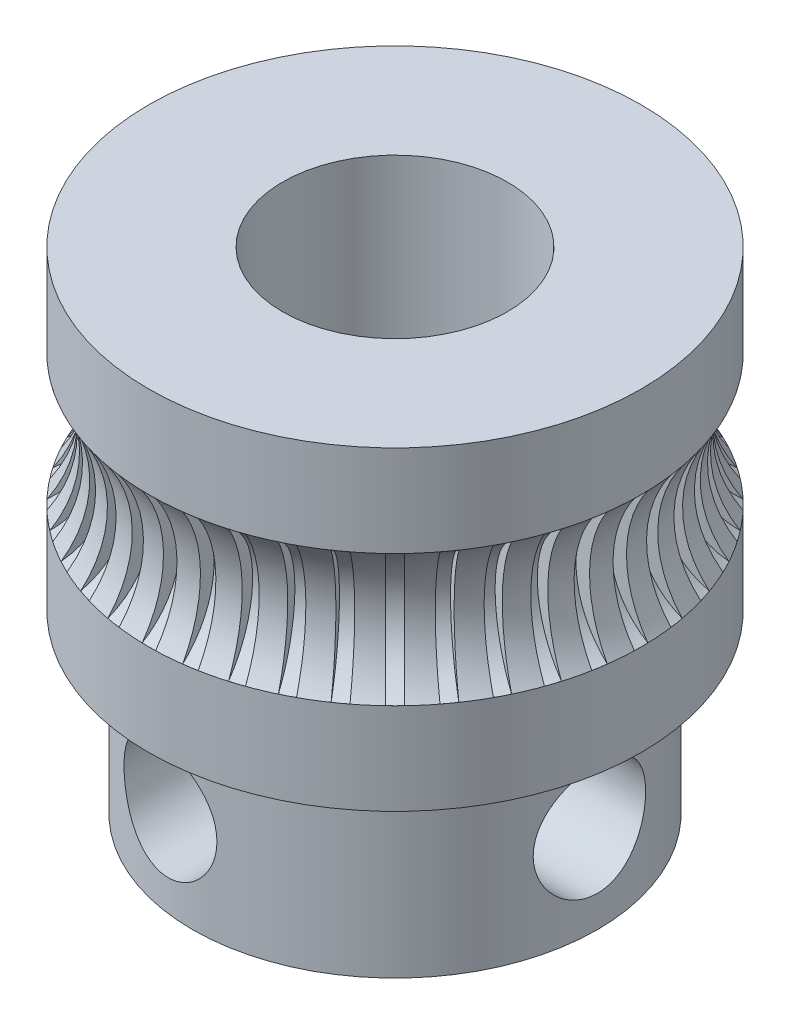
from build123d import *

# Parameters (mm, degrees)
CROQUIS1_W                          = 5.475
CROQUIS1_H                          = 7
CROQUIS2_R                          = 4.5
SALIENTE_EXTRUIR1_DEPTH             = 3.9
DI_METRO_DE_TALADRO_5_0_5_1_D       = 5
DI_METRO_DE_TALADRO_2_5_2_5_1_D     = 2.5
DI_METRO_DE_TALADRO_2_5_2_5_1_DEPTH = 3.309936491
CROQUIS7_W                          = 1.25
CROQUIS7_H                          = 3.960443852
CROQUIS23_R                         = 1.7
CORTAR_EXTRUIR1_DEPTH               = 0.15
MATRIZC1_COUNT                      = 40
CROQUIS15_R                         = 2.5


with BuildPart() as part:
    # Croquis1 → Revolución1 (revolve)
    with BuildSketch(Plane.XY.offset(-56.4)):
        with Locations((78.2375, 52.926431985)):
            Rectangle(CROQUIS1_W, CROQUIS1_H)
    revolve(axis=Axis((75.5, 56.426431985, -56.4), (0, -1, 0)))

    # Croquis2 → Saliente-Extruir1 (add)
    with BuildSketch(Plane.XZ.offset(-49.426431985)):
        with Locations((75.5, -56.4)):
            Circle(CROQUIS2_R)
    extrude(amount=SALIENTE_EXTRUIR1_DEPTH)

    # Diámetro de taladro Ø5.0 (5)1 (through all)
    with Locations(Plane(origin=(0, 56.426431985, 0), x_dir=(1, 0, 0), z_dir=(0, 1, 0))):
        with Locations((75.5, 56.4)):
            Hole(DI_METRO_DE_TALADRO_5_0_5_1_D / 2)

    # Diámetro de taladro Ø2.5 (2.5)1
    with Locations(Plane.ZY.offset(-77.665063509)):
        with Locations((-56.4, 47.476431985)):
            Hole(DI_METRO_DE_TALADRO_2_5_2_5_1_D / 2, depth=DI_METRO_DE_TALADRO_2_5_2_5_1_DEPTH)

    # Croquis7 → Diámetro de taladro Ø2.5 (2.5)2 (revolve, cut)
    with BuildSketch(Plane(origin=(74.761000333, 47.459423849, -54.885443852), x_dir=(0, 1, 0), z_dir=(1, 0, 0))):
        with Locations((0.625, 1.980221926)):
            Rectangle(CROQUIS7_W, CROQUIS7_H)
    revolve(axis=Axis((74.761000333, 47.459423849, -61.235443852), (0, 0, 1)), mode=Mode.SUBTRACT)

    # Croquis23 → Cortar-Extruir1 (cut, symmetric)
    with BuildSketch(Plane.ZY.offset(-75.5)):
        with Locations((-50.064404276, 52.926431985)):
            Circle(CROQUIS23_R)
    cortar_extruir1 = extrude(amount=CORTAR_EXTRUIR1_DEPTH, both=True, mode=Mode.SUBTRACT)

    # MatrizC1: Cortar-Extruir1 ×40 about axis
    matrizc1_axis = Axis((75.5, 56.426431985, -56.4), (0, -1, 0))
    for i in range(1, MATRIZC1_COUNT):
        add(cortar_extruir1.rotate(matrizc1_axis, i * 360 / MATRIZC1_COUNT), mode=Mode.SUBTRACT)

    # Cortar-Barrer1: sweep along a path in Croquis24
    with BuildLine(Plane(origin=(0, 56.426431985, 0), x_dir=(1, 0, 0), z_dir=(0, 1, 0))) as cortar_barrer1_path:
        CenterArc((75.5, 56.4), 7.5, 0, 360)
    # Croquis15 → Cortar-Barrer1 (sweep, cut)
    with BuildSketch(Plane.ZY.offset(-75.5)):
        with Locations((-48.9, 52.926431985)):
            Circle(CROQUIS15_R)
    sweep(path=cortar_barrer1_path.line, mode=Mode.SUBTRACT)


solid = part.part
